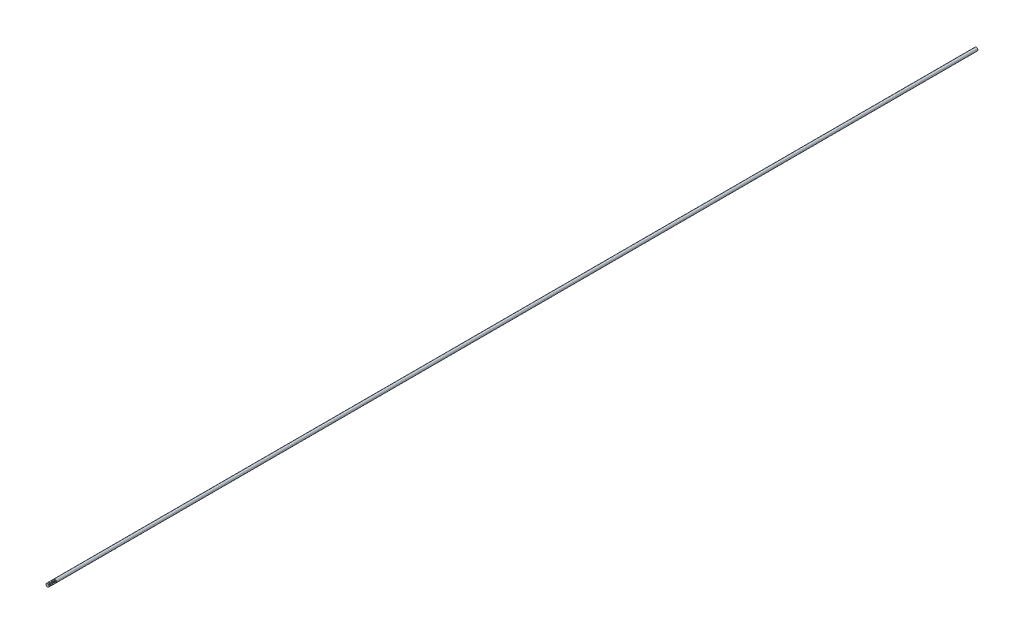
from build123d import *

# Parameters (mm, degrees)
SKETCH1_R           = 3.175
BOSS_EXTRUDE1_DEPTH = 1828.8
THREAD1_PITCH       = 1.27


with BuildPart() as part:
    # Sketch1 → Boss-Extrude1 (new body)
    with BuildSketch(Plane.XY):
        with Locations(Location((0, 0, 0), (0, 0, 180))):
            Circle(SKETCH1_R)
    extrude(amount=BOSS_EXTRUDE1_DEPTH)

    # Thread1: the profile of Thread Profile1 profile screwed along a right-hand helix of 12 turns, 8 arcs to a turn; built about Z, then put on its axis
    thread1_z = Axis((0, 0, 0), (0, 0, 1))
    thread1_corners = [(3.1753, 0, -0.000173205), (3.1753, 0, 1.111423202), (2.487592339, 0, 0.714374998), (2.487592339, 0, 0.396874998)]
    with BuildLine(mode=Mode.PRIVATE) as thread1_profile:
        Line(thread1_corners[0], thread1_corners[1])
        Line(thread1_corners[1], thread1_corners[2])
        Line(thread1_corners[2], thread1_corners[3])
        Line(thread1_corners[3], thread1_corners[0])
    thread1_cap = Face(thread1_profile.wire())
    thread1_turn_angles = [0, 22.5, 45, 67.5, 90, 112.5, 135, 157.5, 180, 202.5, 225, 247.5, 270, 292.5, 315, 337.5, 360]
    thread1_turn_weights = [1, 0.9238795325112867, 1, 0.9238795325112867, 1, 0.9238795325112867, 1, 0.9238795325112867, 1, 0.9238795325112867, 1, 0.9238795325112867, 1, 0.9238795325112867, 1, 0.9238795325112867, 1]
    thread1_turn_rails = [Edge.make_bspline([Vector(p[0], p[1], 0).rotate(thread1_z, thread1_turn_angles[k]) / thread1_turn_weights[k] + Vector(0, 0, p[2] + THREAD1_PITCH * thread1_turn_angles[k] / 360) for k in range(17)], [0, 0, 0, 1, 1, 2, 2, 3, 3, 4, 4, 5, 5, 6, 6, 7, 7, 8, 8, 8], 2, thread1_turn_weights) for p in thread1_corners]
    thread1_turn_sides = [Face.make_surface_from_curves(thread1_turn_rails[p[0]], thread1_turn_rails[p[1]]) for p in [(0, 1), (1, 2), (2, 3), (3, 0)]]
    thread1 = Plane(origin=(0, 0, 1829.8), x_dir=(-1, 0, 0), z_dir=(0, 0, -1)) * Solid(Shell([*[p.moved(Location((0, 0, THREAD1_PITCH * i))) for i in range(12) for p in thread1_turn_sides], thread1_cap, thread1_cap.rotate(thread1_z, 4320).moved(Location((0, 0, THREAD1_PITCH * 4320 / 360)))]))
    add(thread1, mode=Mode.SUBTRACT)


solid = part.part
